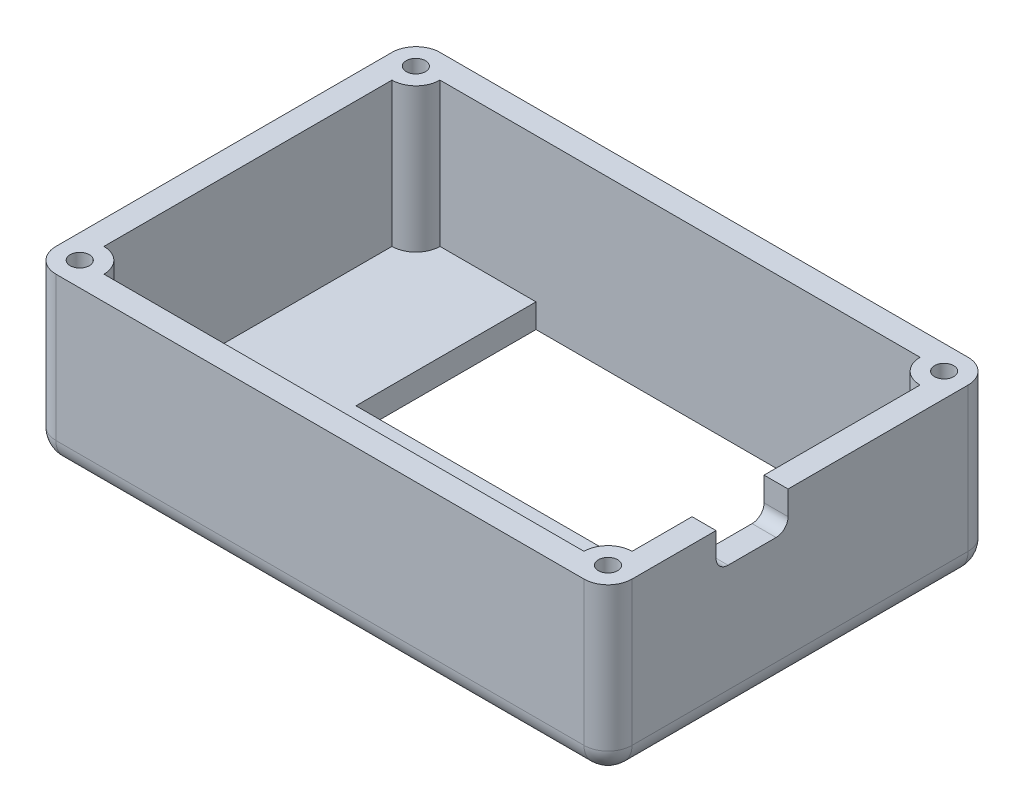
from build123d import *

# Parameters (mm, degrees)
SKETCH1_W           = 60.96
SKETCH1_H           = 40.64
BOSS_EXTRUDE1_DEPTH = 17.78
SHELL1_T            = -2.54
SKETCH2_R           = 2.54
BOSS_EXTRUDE2_DEPTH = 17.78
SKETCH3_R           = 1.016
CUT_EXTRUDE2_DEPTH  = 7.62
SKETCH5_W           = 7.62
SKETCH5_H           = 3.81
CUT_EXTRUDE3_DEPTH  = 2.54
FILLET1_R           = 1.27
SKETCH6_W           = 40.64
SKETCH6_H           = 19.05
CUT_EXTRUDE4_DEPTH  = 2.54
FILLET3_R           = 2.54


with BuildPart() as part:
    # Sketch1 → Boss-Extrude1 (new body)
    with BuildSketch(Plane(origin=(0, 0, 0), x_dir=(1, 0, 0), z_dir=(0, 1, 0))):
        with Locations((30.48, 20.32)):
            Rectangle(SKETCH1_W, SKETCH1_H)
    extrude(amount=BOSS_EXTRUDE1_DEPTH)

    # Shell1
    shell1_openings = [part.faces().sort_by_distance(p)[0] for p in [
        (30.48, 17.78, -20.32),
    ]]
    offset(amount=SHELL1_T, openings=shell1_openings, kind=Kind.INTERSECTION)

    # Sketch2 → Boss-Extrude2 (add)
    with BuildSketch(Plane(origin=(0, 17.78, 0), x_dir=(1, 0, 0), z_dir=(0, 1, 0))):
        with Locations((2.54, 2.54)):
            Circle(SKETCH2_R)
        with Locations((58.42, 2.54)):
            Circle(SKETCH2_R)
        with Locations((58.42, 38.1)):
            Circle(SKETCH2_R)
        with Locations((2.54, 38.1)):
            Circle(SKETCH2_R)
    extrude(amount=-BOSS_EXTRUDE2_DEPTH)

    # Sketch3 → Cut-Extrude2 (cut)
    with BuildSketch(Plane(origin=(0, 17.78, 0), x_dir=(1, 0, 0), z_dir=(0, 1, 0))):
        with Locations(Location((2.525101816, 38.1, 0), (0, 0, 270))):
            Circle(SKETCH3_R)
        with Locations(Location((2.525101816, 2.54, 0), (0, 0, 270))):
            Circle(SKETCH3_R)
        with Locations(Location((58.42, 2.54, 0), (0, 0, 270))):
            Circle(SKETCH3_R)
        with Locations(Location((58.42, 38.1, 0), (0, 0, 270))):
            Circle(SKETCH3_R)
    extrude(amount=-CUT_EXTRUDE2_DEPTH, mode=Mode.SUBTRACT)

    # Sketch5 → Cut-Extrude3 (cut)
    with BuildSketch(Plane(origin=(60.96, 0, 0), x_dir=(0, 0, -1), z_dir=(1, 0, 0))):
        with Locations((15.24, 15.875)):
            Rectangle(SKETCH5_W, SKETCH5_H)
    extrude(amount=-CUT_EXTRUDE3_DEPTH, mode=Mode.SUBTRACT)

    # Fillet1
    fillet1_edges = [part.edges().sort_by_distance(p)[0] for p in [
        (59.69, 13.97, -19.05),
        (59.69, 13.97, -11.43),
    ]]
    fillet(fillet1_edges, radius=FILLET1_R)

    # Sketch6 → Cut-Extrude4 (cut)
    with BuildSketch(Plane.XZ):
        with Locations((35.56, -28.575)):
            Rectangle(SKETCH6_W, SKETCH6_H)
    extrude(amount=-CUT_EXTRUDE4_DEPTH, mode=Mode.SUBTRACT)

    # Fillet3
    fillet3_edges = [part.edges().sort_by_distance(p)[0] for p in [
        (30.48, 0, -40.64),
        (60.96, 0, -20.32),
        (30.48, 0, 0),
        (0, 0, -20.32),
        (0, 8.89, -40.64),
        (60.96, 8.89, -40.64),
        (60.96, 8.89, 0),
        (0, 8.89, 0),
    ]]
    fillet(fillet3_edges, radius=FILLET3_R - 0.0001)  # a hair under: the kernel refuses the full size


solid = part.part
